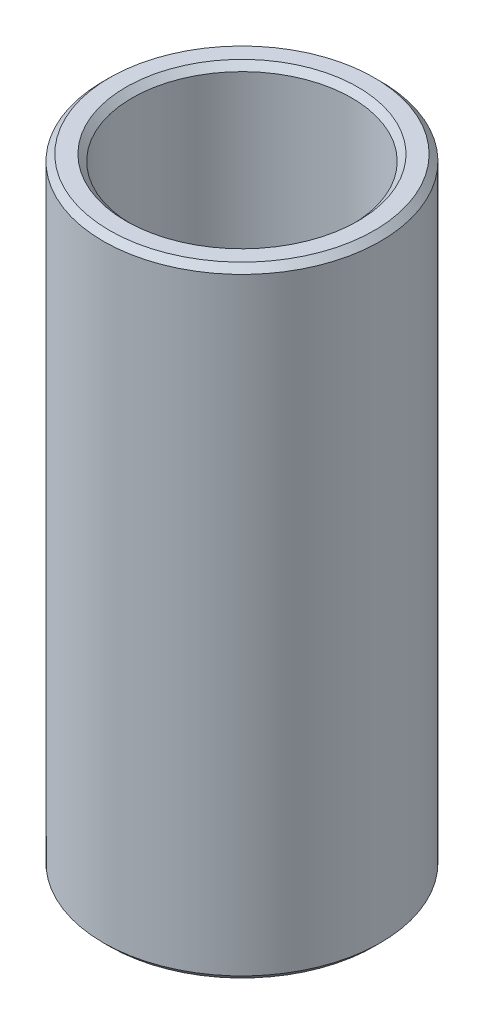
from build123d import *

# Parameters (mm, degrees)
SKETCH1_R           = 52.5
BOSS_EXTRUDE1_DEPTH = 234.848804561
SKETCH2_R           = 41.592589353
CUT_EXTRUDE1_DEPTH  = 247.305625197
CHAMFER1_SIZE       = 2.356700954


with BuildPart() as part:
    # Sketch1 → Boss-Extrude1 (new body)
    with BuildSketch(Plane(origin=(0, 0, 0), x_dir=(1, 0, 0), z_dir=(0, 1, 0))):
        Circle(SKETCH1_R)
    extrude(amount=BOSS_EXTRUDE1_DEPTH)

    # Sketch2 → Cut-Extrude1 (cut, through all)
    with BuildSketch(Plane(origin=(0, 0, 0), x_dir=(1, 0, 0), z_dir=(0, 1, 0))):
        Circle(SKETCH2_R)
    extrude(amount=CUT_EXTRUDE1_DEPTH, mode=Mode.SUBTRACT)

    # Chamfer1
    chamfer1_edges = [part.edges().sort_by_distance(p)[0] for p in [
        (-41.592589353, 234.848804561, 0),
        (-41.592589353, 0, 0),
        (-52.5, 0, 0),
        (-52.5, 234.848804561, 0),
    ]]
    chamfer(chamfer1_edges, length=CHAMFER1_SIZE)


solid = part.part
